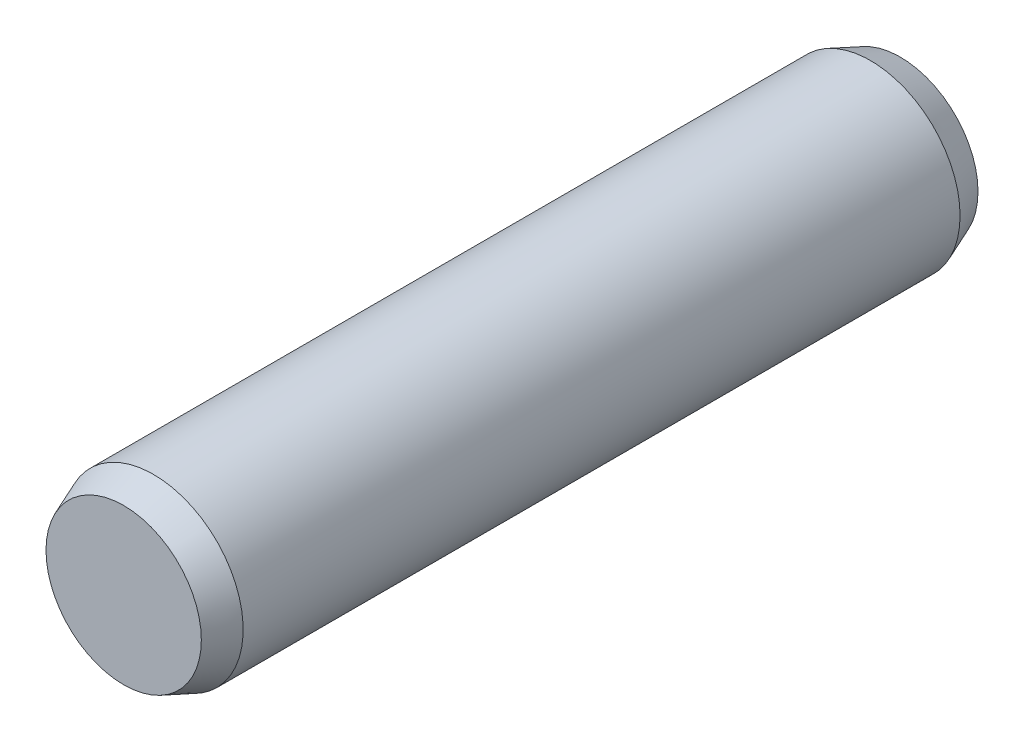
from build123d import *

# Parameters (mm, degrees)
SKETCH1_R           = 1.5
BOSS_EXTRUDE1_DEPTH = 6.5
CHAMFER1_SIZE       = 0.5
CHAMFER1_SIZE2      = 0.2
CHAMFER2_SIZE       = 0.2
CHAMFER2_SIZE2      = 0.5


with BuildPart() as part:
    # Sketch1 → Boss-Extrude1 (new, symmetric)
    with BuildSketch(Plane.XY):
        Circle(SKETCH1_R)
    extrude(amount=BOSS_EXTRUDE1_DEPTH, both=True)

    # Chamfer1
    chamfer1_edges = [part.edges().sort_by_distance(p)[0] for p in [
        (-1.5, 0, 6.5),
    ]]
    chamfer1_side = [part.faces().sort_by_distance(p)[0] for p in [
        (-1.5, 0, 0),
    ]]
    chamfer(chamfer1_edges, length=CHAMFER1_SIZE, length2=CHAMFER1_SIZE2, reference=chamfer1_side[0])

    # Chamfer2
    chamfer2_edges = [part.edges().sort_by_distance(p)[0] for p in [
        (-1.5, 0, -6.5),
    ]]
    chamfer2_side = [part.faces().sort_by_distance(p)[0] for p in [
        (0, 0, -6.5),
    ]]
    chamfer(chamfer2_edges, length=CHAMFER2_SIZE, length2=CHAMFER2_SIZE2, reference=chamfer2_side[0])


solid = part.part
